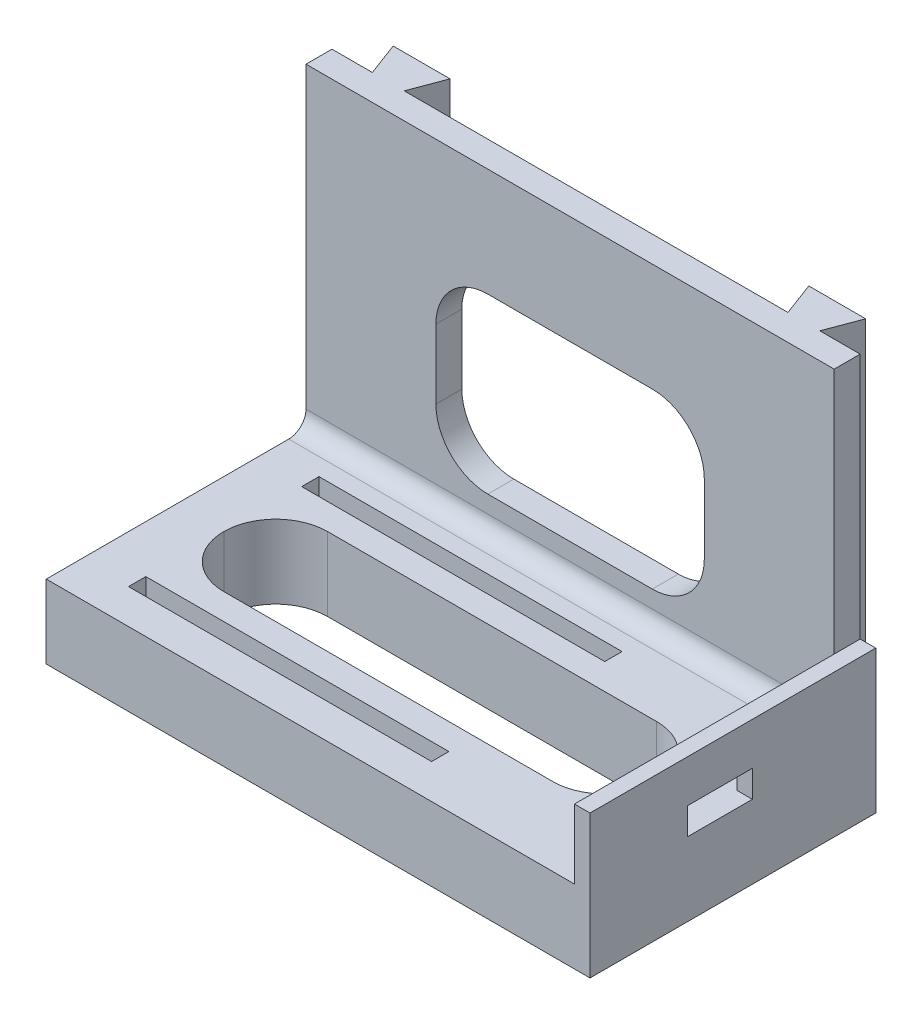
from build123d import *

# Parameters (mm, degrees)
SKETCH1_W           = 61
SKETCH1_H           = 45
BOSS_EXTRUDE1_DEPTH = 3
BOSS_EXTRUDE2_DEPTH = 38.5
SKETCH3_W           = 61
SKETCH3_H           = 30
BOSS_EXTRUDE3_DEPTH = 8.5
SKETCH4_W           = 35
SKETCH4_H           = 2
CUT_EXTRUDE1_DEPTH  = 8.5
SKETCH5_W           = 33
SKETCH5_H           = 16.5
SKETCH5_W_2         = 7.5
SKETCH5_H_2         = 3.1
BOSS_EXTRUDE4_DEPTH = 1.8
CUT_EXTRUDE2_REACH  = 60.86
SKETCH6_W           = 50
SKETCH6_H           = 12
CUT_EXTRUDE3_REACH  = 53.367
SKETCH7_W           = 31
SKETCH7_H           = 20
FILLET1_R           = 6
FILLET2_R           = 2


with BuildPart() as part:
    # Sketch1 → Boss-Extrude1 (new body)
    with BuildSketch(Plane.XY):
        Rectangle(SKETCH1_W, SKETCH1_H)
    extrude(amount=BOSS_EXTRUDE1_DEPTH)

    # Sketch2 → Boss-Extrude2 (add)
    with BuildSketch(Plane(origin=(0, 22.5, 0), x_dir=(1, 0, 0), z_dir=(0, 1, 0))):
        Polygon((-25.83979993, 0), (-27.28354993, 3.85), (-20.71645007, 3.85), (-22.16020007, 0), align=None)
        Polygon((20.71645007, 3.85), (22.16020007, 0), (25.83979993, 0), (27.28354993, 3.85), align=None)
    extrude(amount=-BOSS_EXTRUDE2_DEPTH)

    # Sketch3 → Boss-Extrude3 (add)
    with BuildSketch(Plane.XZ.offset(22.5)):
        with Locations((0, 18)):
            Rectangle(SKETCH3_W, SKETCH3_H)
    extrude(amount=-BOSS_EXTRUDE3_DEPTH)

    # Sketch4 → Cut-Extrude1 (cut)
    with BuildSketch(Plane(origin=(0, -14, 0), x_dir=(1, 0, 0), z_dir=(0, 1, 0))):
        with Locations((-7.5, -8)):
            Rectangle(SKETCH4_W, SKETCH4_H)
        with Locations((-7.5, -28)):
            Rectangle(SKETCH4_W, SKETCH4_H)
    extrude(amount=-CUT_EXTRUDE1_DEPTH, mode=Mode.SUBTRACT)

    # Sketch5 → Boss-Extrude4 (add)
    with BuildSketch(Plane(origin=(30.5, 0, 0), x_dir=(0, 0, -1), z_dir=(1, 0, 0))):
        with Locations((-16.5, -14.25)):
            Rectangle(SKETCH5_W, SKETCH5_H)
        with Locations((-18, -12.45)):
            Rectangle(SKETCH5_W_2, SKETCH5_H_2, mode=Mode.SUBTRACT)
    extrude(amount=BOSS_EXTRUDE4_DEPTH)

    # Sketch6 → Cut-Extrude2 (cut, up to next)
    with BuildSketch(Plane(origin=(0, -14, 0), x_dir=(1, 0, 0), z_dir=(0, 1, 0)), mode=Mode.PRIVATE) as cut_extrude2_sk1:
        with Locations((0, -18)):
            Rectangle(SKETCH6_W, SKETCH6_H)
    cut_extrude2_tool1 = extrude(cut_extrude2_sk1.sketch, amount=-CUT_EXTRUDE2_REACH, mode=Mode.PRIVATE) & part.part
    add(cut_extrude2_tool1.solids().sort_by_distance((0, -14, 18))[0], mode=Mode.SUBTRACT)

    # Sketch7 → Cut-Extrude3 (cut, up to next)
    with BuildSketch(Plane(origin=(0, 0, 0), x_dir=(-1, 0, 0), z_dir=(0, 0, -1)), mode=Mode.PRIVATE) as cut_extrude3_sk1:
        Rectangle(SKETCH7_W, SKETCH7_H)
    cut_extrude3_tool1 = extrude(cut_extrude3_sk1.sketch, amount=-CUT_EXTRUDE3_REACH, mode=Mode.PRIVATE) & part.part
    add(cut_extrude3_tool1.solids().sort_by_distance((0, 0, 0))[0], mode=Mode.SUBTRACT)

    # Fillet1
    fillet1_edges = [part.edges().sort_by_distance(p)[0] for p in [
        (-25, -18.25, 24),
        (-25, -18.25, 12),
        (25, -18.25, 24),
        (25, -18.25, 12),
        (-15.5, -10, 1.5),
        (-15.5, 10, 1.5),
        (15.5, 10, 1.5),
        (15.5, -10, 1.5),
    ]]
    fillet(fillet1_edges, radius=FILLET1_R - 0.0001)  # a hair under: the kernel refuses the full size

    # Fillet2
    fillet2_edges = [part.edges().sort_by_distance(p)[0] for p in [
        (0, -14, 3),
    ]]
    fillet(fillet2_edges, radius=FILLET2_R)


solid = part.part
